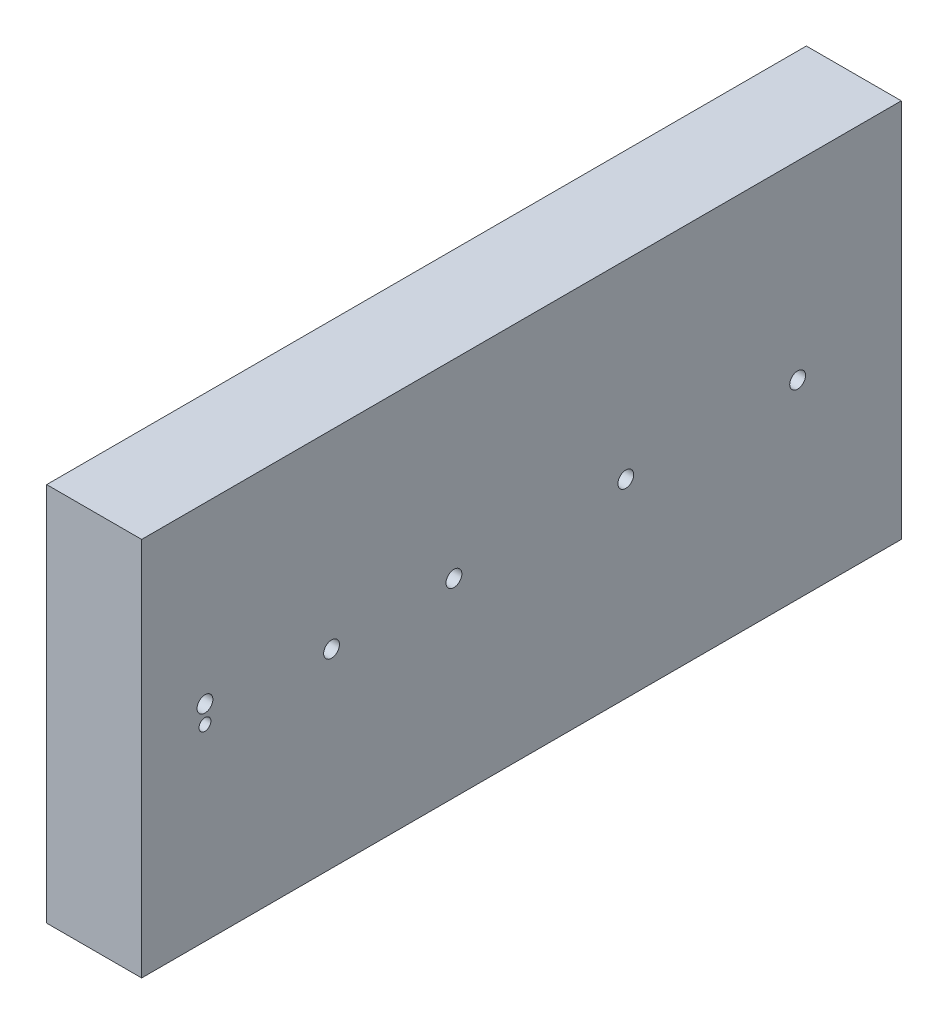
from build123d import *

# Parameters (mm, degrees)
SKETCH1_W                       = 152.4
SKETCH1_H                       = 76.2
SKETCH1_R                       = 1.5875
SKETCH1_R_2                     = 1.190625
BOSS_EXTRUDE1_DEPTH             = 19.05
F_1_4_0_25_DIAMETER_HOLE2_D     = 6.35
F_1_4_0_25_DIAMETER_HOLE2_DEPTH = 12.7
F_1_4_0_25_DIAMETER_HOLE2_TIP   = 1.907732465


with BuildPart() as part:
    # Sketch1 → Boss-Extrude1 (new body)
    with BuildSketch(Plane(origin=(0, 0, 0), x_dir=(0, 0, -1), z_dir=(1, 0, 0))):
        Rectangle(SKETCH1_W, SKETCH1_H)
        with Locations((55.404, 0)):
            Circle(SKETCH1_R, mode=Mode.SUBTRACT)
        with Locations((20.927, 0)):
            Circle(SKETCH1_R, mode=Mode.SUBTRACT)
        with Locations((-13.55, 0)):
            Circle(SKETCH1_R, mode=Mode.SUBTRACT)
        with Locations((-38.1, 0)):
            Circle(SKETCH1_R, mode=Mode.SUBTRACT)
        with Locations((-63.5, 3.175)):
            Circle(SKETCH1_R, mode=Mode.SUBTRACT)
        with Locations((-63.5, -0.396875)):
            Circle(SKETCH1_R_2, mode=Mode.SUBTRACT)
    extrude(amount=BOSS_EXTRUDE1_DEPTH)

    # 1/4 (0.25) Diameter Hole2
    with Locations(Plane.XZ.offset(38.1)):
        with Locations((9.525, 57.15), (9.525, -63.5), (9.525, 0)):
            Hole(F_1_4_0_25_DIAMETER_HOLE2_D / 2, depth=F_1_4_0_25_DIAMETER_HOLE2_DEPTH)
            with Locations((0, 0, -(F_1_4_0_25_DIAMETER_HOLE2_DEPTH + F_1_4_0_25_DIAMETER_HOLE2_TIP / 2))):  # 118° drill point
                Cone(0, F_1_4_0_25_DIAMETER_HOLE2_D / 2, F_1_4_0_25_DIAMETER_HOLE2_TIP, mode=Mode.SUBTRACT)


solid = part.part
